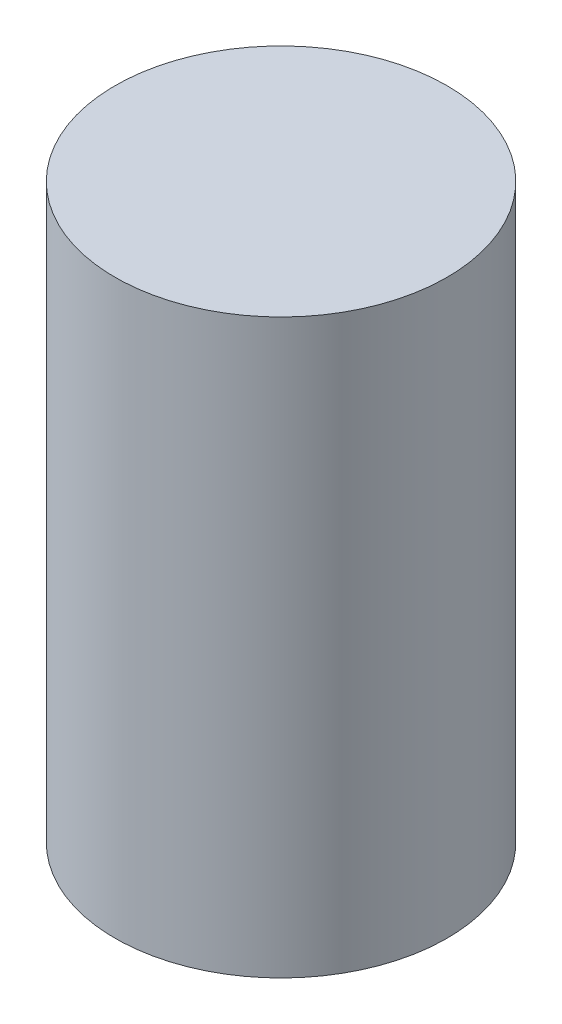
from build123d import *

# Parameters (mm, degrees)
SKETCH1_R           = 3.683
BOSS_EXTRUDE1_DEPTH = 12.7


with BuildPart() as part:
    # Sketch1 → Boss-Extrude1 (new body)
    with BuildSketch(Plane(origin=(0, 0, 0), x_dir=(1, 0, 0), z_dir=(0, 1, 0))):
        Circle(SKETCH1_R)
    extrude(amount=BOSS_EXTRUDE1_DEPTH)


solid = part.part
